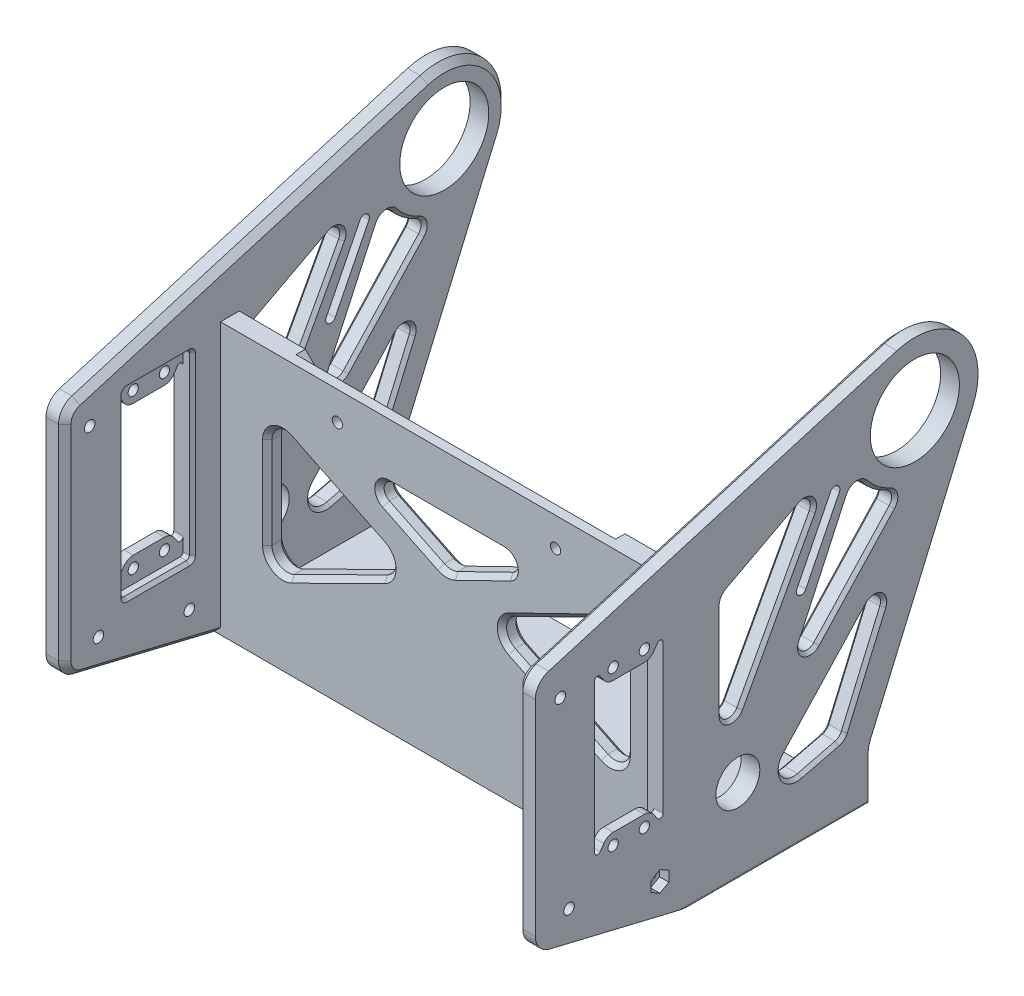
from build123d import *
from OCP.BRepFilletAPI import BRepFilletAPI_MakeFillet

# Parameters (mm, degrees)
SKETCH1_W                = 157
SKETCH1_H                = 87
SKETCH1_W_2              = 145
SKETCH1_H_2              = 75
BOSS_EXTRUDE1_DEPTH      = 50.8
SKETCH2_W                = 157
SKETCH2_H                = 87
BOSS_EXTRUDE2_DEPTH      = 6
SKETCH3_W                = 145
SKETCH3_H                = 7.840397899
CUT_EXTRUDE1_DEPTH       = 179.725040215
CUT_EXTRUDE2_DEPTH       = 179.725040215
FILLET2_R1               = 5
FILLET2_R2               = 3
SKETCH7_R                = 20.2875
SKETCH7_R_2              = 14.2875
BOSS_EXTRUDE3_DEPTH      = 6
FILLET3_R                = 10
CHAMFER2_SIZE            = 5
CUT_EXTRUDE3_DEPTH       = 204.465040379
FILLET4_R1               = 3
FILLET4_R2               = 5
MIRROR2_START            = 145
MIRROR2_DEPTH            = 6
SKETCH10_R               = 7.05
CUT_EXTRUDE4_DEPTH       = 204.465040379
FILLET5_R                = 5
SKETCH12_R               = 1.65
CUT_EXTRUDE9_DEPTH       = 3
SKETCH12_7_R             = 1.65
CUT_EXTRUDE10_DEPTH      = 210.128764909
SKETCH13_R               = 1.65
BOSS_EXTRUDE4_DEPTH      = 6
FILLET6_R                = 1
FILLET6_OF_MIRROR4_R     = 1
CHAMFER3_SIZE            = 6
BOSS_EXTRUDE5_DEPTH      = 6
BOSS_EXTRUDE6_START      = -6
BOSS_EXTRUDE6_DEPTH      = 6
CUT_EXTRUDE11_DEPTH      = 219.472018017
CUT_EXTRUDE11_DEPTH_BACK = 10
SKETCH16_R               = 1.7
FILLET7_R                = 6
CUT_EXTRUDE12_DEPTH      = 3
CUT_EXTRUDE13_DEPTH      = 223.661228453
SKETCH19_W               = 22
SKETCH19_H               = 8
CUT_EXTRUDE14_DEPTH      = 3
FILLET8_R                = 1
CHAMFER4_SIZE            = 1
FILLET8_OF_MIRROR9_R     = 1
CHAMFER5_SIZE            = 1
CHAMFER6_SIZE            = 1
CHAMFER7_SIZE            = 1
CHAMFER8_SIZE            = 2
FILLET9_R                = 1
CHAMFER9_SIZE            = 1.5
CHAMFER10_SIZE           = 1.5


# Read off the part's stored shape, not the designer's step: Mirror2
with BuildPart() as part:
    # Sketch1 → Boss-Extrude1 (new body)
    with BuildSketch(Plane.XY):
        with Locations((72.5, 37.5)):
            Rectangle(SKETCH1_W, SKETCH1_H)
        with Locations((72.5, 37.5)):
            Rectangle(SKETCH1_W_2, SKETCH1_H_2, mode=Mode.SUBTRACT)
    extrude(amount=BOSS_EXTRUDE1_DEPTH)

    # Sketch2 → Boss-Extrude2 (add)
    with BuildSketch(Plane.XY.offset(50.8)):
        with Locations((72.5, 37.5)):
            Rectangle(SKETCH2_W, SKETCH2_H)
    extrude(amount=BOSS_EXTRUDE2_DEPTH)

    # Sketch3 → Cut-Extrude1 (cut, through all)
    with BuildSketch(Plane(origin=(0, 0, 50.8), x_dir=(-1, 0, 0), z_dir=(0, 0, -1))):
        with Locations((-72.5, 78.92019895)):
            Rectangle(SKETCH3_W, SKETCH3_H)
    extrude(amount=CUT_EXTRUDE1_DEPTH, mode=Mode.SUBTRACT)

    # Sketch5 → Cut-Extrude2 (cut, through all)
    with BuildSketch(Plane(origin=(0, 0, 50.8), x_dir=(-1, 0, 0), z_dir=(0, 0, -1))):
        Polygon((-130, 62.996404041), (-83.900811392, 40.5), (-130, 18.003595959), align=None)
        Polygon((-72.534927555, 47.159270504), (-104.039713028, 62.533605815), (-40.991844554, 62.552295009), align=None)
        Polygon((-61.169043718, 40.465910706), (-15, 62.996404041), (-15, 17.590444841), align=None)
    extrude(amount=-CUT_EXTRUDE2_DEPTH, mode=Mode.SUBTRACT)

    # Fillet2: one fillet with a radius per group of edges: ONE call of the kernel's fillet builder (fillet() takes one radius for all edges)
    fillet2_edges_1 = [part.edges().sort_by_distance(p)[0] for p in [
        (130, 62.996404041, 53.8),
        (130, 18.003595959, 53.8),
        (83.900811392, 40.5, 53.8),
        (61.169043718, 40.465910706, 53.8),
        (15, 17.590444841, 53.8),
        (15, 62.996404041, 53.8),
        (72.534927555, 47.159270504, 53.8),
    ]]
    fillet2_edges_2 = [part.edges().sort_by_distance(p)[0] for p in [
        (104.039713028, 62.533605815, 53.8),
        (40.991844554, 62.552295009, 53.8),
    ]]
    fillet2 = BRepFilletAPI_MakeFillet(part.part.solid().wrapped)
    for e in fillet2_edges_1:
        fillet2.Add(FILLET2_R1, e.wrapped)
    for e in fillet2_edges_2:
        fillet2.Add(FILLET2_R2, e.wrapped)
    add(Compound.cast(fillet2.Shape()), mode=Mode.REPLACE)

    # Sketch7 → Boss-Extrude3 (add)
    # profile 1 of 2: a face of its own
    with BuildSketch(Plane.ZY.offset(6)):
        with BuildLine():
            Line((-33.628509731, 87.964996486), (0, 10))
            Line((0, 10), (0, 81))
            Line((0, 81), (56.8, 81))
            Line((56.8, 81), (-5.520454784, 113.936579349))
            ThreePointArc((-5.520454784, 113.936579349), (2.376693152, 106.470586963), (5.2875, 96))
            ThreePointArc((5.2875, 96), (-10.897758839, 76.131575963), (-33.628509731, 87.964996486))
        make_face()
    # profile 2 of 2: a face of its own
    with BuildSketch(Plane.ZY.offset(6)):
        with Locations((-15, 96)):
            Circle(SKETCH7_R)
        with Locations((-15, 96)):
            Circle(SKETCH7_R_2, mode=Mode.SUBTRACT)
    boss_extrude3 = extrude(amount=-BOSS_EXTRUDE3_DEPTH)

    # Mirror1: Boss-Extrude3 across plane
    add(boss_extrude3.mirror(Plane.ZY.offset(-72.5)))

    # Fillet3
    fillet3_edges = [part.edges().sort_by_distance(p)[0] for p in [
        (-3, 10, 0),
        (148, 10, 0),
    ]]
    fillet(fillet3_edges, radius=FILLET3_R)

    # Chamfer2
    chamfer2_edges = [part.edges().sort_by_distance(p)[0] for p in [
        (72.5, 0, 0),
    ]]
    chamfer(chamfer2_edges, length=CHAMFER2_SIZE)

    # Sketch8 → Cut-Extrude3 (cut, through all)
    with BuildSketch(Plane.ZY.offset(6)):
        with BuildLine():
            ThreePointArc((3.752781989, 88.259468757), (-2.075402811, 80.362306955), (-10.928651819, 76.125222511))
            Line((-10.928651819, 76.125222511), (29.206818786, 32.995321266))
            Line((29.206818786, 32.995321266), (3.752781989, 88.259468757))
        make_face()
        Polygon((13.217506745, 92.722815779), (46.8, 30.524174725), (46.8, 74.974350084), align=None)
        Polygon((-11.620030094, 62.189005636), (8.20858058, 16.217965768), (37.949320184, 8.921381013), align=None)
    extrude(amount=-CUT_EXTRUDE3_DEPTH, mode=Mode.SUBTRACT)

    # Fillet4: one fillet with a radius per group of edges: ONE call of the kernel's fillet builder (fillet() takes one radius for all edges)
    fillet4_edges_1 = [part.edges().sort_by_distance(p)[0] for p in [
        (-3, 16.217965768, 8.20858058),
        (-3, 62.189005636, -11.620030094),
        (-3, 88.259468757, 3.752781989),
        (-3, 76.125222511, -10.928651819),
        (-3, 32.995321266, 29.206818786),
        (-3, 30.524174725, 46.8),
        (-3, 74.974350084, 46.8),
        (-3, 92.722815779, 13.217506745),
    ]]
    fillet4_edges_2 = [part.edges().sort_by_distance(p)[0] for p in [
        (-3, 8.921381013, 37.949320184),
    ]]
    fillet4 = BRepFilletAPI_MakeFillet(part.part.solid().wrapped)
    for e in fillet4_edges_1:
        fillet4.Add(FILLET4_R1, e.wrapped)
    for e in fillet4_edges_2:
        fillet4.Add(FILLET4_R2, e.wrapped)
    add(Compound.cast(fillet4.Shape()), mode=Mode.REPLACE)

    # Mirror2 outline → Mirror2 (add)
    with BuildSketch(Plane.YZ.offset(MIRROR2_START)):
        with BuildLine():
            Line((8.921381013, 37.949320184), (12.908216965, 21.699053259))
            ThreePointArc((12.908216965, 21.699053259), (15.23237265, 27.202011091), (21.170392855, 26.550734968))
            Line((21.170392855, 26.550734968), (8.921381013, 37.949320184))
        make_face()
        with BuildLine():
            ThreePointArc((17.587900615, 7.617688905), (16.485574848, 8.434939061), (15.862476884, 9.657546455))
            Line((15.862476884, 9.657546455), (16.217965768, 8.20858058))
            Line((16.217965768, 8.20858058), (17.587900615, 7.617688905))
        make_face()
        with BuildLine():
            Line((62.189005636, -11.620030094), (49.480039969, 0.206575189))
            ThreePointArc((49.480039969, 0.206575189), (49.948450835, -3.629504451), (46.248158166, -4.744291386))
            Line((46.248158166, -4.744291386), (62.189005636, -11.620030094))
        make_face()
        with BuildLine():
            Line((92.722815779, 13.217506745), (88.105787624, 21.953547344))
            ThreePointArc((88.105787624, 21.953547344), (87.565304606, 18.421043559), (84.02813848, 17.911965287))
            Line((84.02813848, 17.911965287), (92.722815779, 13.217506745))
        make_face()
        with BuildLine():
            ThreePointArc((73.16665511, 46.8), (74.714985899, 46.369566455), (75.819014348, 45.201781178))
            Line((75.819014348, 45.201781178), (74.974350084, 46.8))
            Line((74.974350084, 46.8), (73.16665511, 46.8))
        make_face()
        with BuildLine():
            Line((30.524174725, 46.8), (40.969734793, 41.16019912))
            ThreePointArc((40.969734793, 41.16019912), (39.486468129, 44.535050121), (42.395024699, 46.8))
            Line((42.395024699, 46.8), (30.524174725, 46.8))
        make_face()
        with BuildLine():
            ThreePointArc((46.69882818, 16.454721446), (46.250615365, 20.321333526), (49.997579853, 21.375772161))
            Line((49.997579853, 21.375772161), (32.995321266, 29.206818786))
            Line((32.995321266, 29.206818786), (46.69882818, 16.454721446))
        make_face()
        with BuildLine():
            Line((88.259468757, 3.752781989), (83.028913363, 6.16191622))
            ThreePointArc((83.028913363, 6.16191622), (84.754813933, 3.774679153), (83.606546294, 1.061910269))
            ThreePointArc((83.606546294, 1.061910269), (85.843497889, 2.562121772), (88.259468757, 3.752781989))
        make_face()
        with BuildLine():
            ThreePointArc((77.466372753, -6.748496057), (75.325371633, -8.467770526), (72.682014243, -7.724499242))
            Line((72.682014243, -7.724499242), (76.125222511, -10.928651819))
            ThreePointArc((76.125222511, -10.928651819), (76.682396263, -8.802190539), (77.466372753, -6.748496057))
        make_face()
    extrude(amount=MIRROR2_DEPTH)

    # Sketch10 → Cut-Extrude4 (cut, through all)
    with BuildSketch(Plane(origin=(151, 0, 0), x_dir=(0, 0, -1), z_dir=(1, 0, 0))):
        with Locations((-41.8, 21)):
            Circle(SKETCH10_R)
    extrude(amount=-CUT_EXTRUDE4_DEPTH, mode=Mode.SUBTRACT)

    # Fillet5
    fillet5_edges = [part.edges().sort_by_distance(p)[0] for p in [
        (72.5, 0, 50.8),
    ]]
    fillet(fillet5_edges, radius=FILLET5_R)

    # Sketch12 → Cut-Extrude9 (cut)
    # profile 1 of 2: a face of its own
    with BuildSketch(Plane(origin=(0, 0, 50.8), x_dir=(-1, 0, 0), z_dir=(0, 0, -1))):
        with BuildLine():
            Line((-72.5, 66.795063192), (-72.5, 81))
            Line((-72.5, 81), (-123.78828295, 81))
            Line((-123.78828295, 81), (-111.047812236, 68.259529286))
            ThreePointArc((-111.047812236, 68.259529286), (-109.425695492, 67.17566553), (-107.51227833, 66.795063192))
            Line((-107.51227833, 66.795063192), (-72.5, 66.795063192))
        make_face()
        with Locations((-107.51227833, 71.795063192)):
            Circle(SKETCH12_R, mode=Mode.SUBTRACT)
    # profile 2 of 2: a face of its own
    with BuildSketch(Plane(origin=(0, 0, 50.8), x_dir=(-1, 0, 0), z_dir=(0, 0, -1))):
        with BuildLine():
            Line((-21.21171705, 81), (-72.5, 81))
            Line((-72.5, 81), (-72.5, 66.795063192))
            Line((-72.5, 66.795063192), (-37.48772167, 66.795063192))
            ThreePointArc((-37.48772167, 66.795063192), (-35.574304508, 67.17566553), (-33.952187764, 68.259529286))
            Line((-33.952187764, 68.259529286), (-21.21171705, 81))
        make_face()
        with Locations((-37.48772167, 71.795063192)):
            Circle(SKETCH12_R, mode=Mode.SUBTRACT)
    extrude(amount=-CUT_EXTRUDE9_DEPTH, mode=Mode.SUBTRACT)

    # Sketch12<7> → Cut-Extrude10 (cut, through all)
    with BuildSketch(Plane(origin=(0, 0, 50.8), x_dir=(-1, 0, 0), z_dir=(0, 0, -1))):
        with Locations((-107.51227833, 71.795063192)):
            Circle(SKETCH12_7_R)
        with Locations((-37.48772167, 71.795063192)):
            Circle(SKETCH12_7_R)
    extrude(amount=-CUT_EXTRUDE10_DEPTH, mode=Mode.SUBTRACT)

    # Sketch13 → Boss-Extrude4 (add)
    with BuildSketch(Plane(origin=(151, 0, 0), x_dir=(0, 0, -1), z_dir=(1, 0, 0))):
        Polygon((-56.8, -6), (-56.8, 81), (-106.8, 81), (-106.8, 6), align=None)
        with Locations((-81.80010225, 23.5)):
            Circle(SKETCH13_R, mode=Mode.SUBTRACT)
        with Locations((-71.80010225, 23.5)):
            Circle(SKETCH13_R, mode=Mode.SUBTRACT)
        with Locations((-81.80010225, 73)):
            Circle(SKETCH13_R, mode=Mode.SUBTRACT)
        with BuildLine():
            ThreePointArc((-68.800093231, 25.579049274), (-70.106884876, 26.733498867), (-71.80010225, 27.15))
            Line((-71.80010225, 27.15), (-81.80010225, 27.15))
            ThreePointArc((-81.80010225, 27.15), (-83.49337122, 26.733471849), (-84.800177618, 25.578953532))
            Line((-84.800177618, 25.578953532), (-87.8, 21.25))
            Line((-87.8, 21.25), (-87.8, 75.25))
            Line((-87.8, 75.25), (-84.800177618, 70.921046468))
            ThreePointArc((-84.800177618, 70.921046468), (-83.49337122, 69.766528151), (-81.80010225, 69.35))
            Line((-81.80010225, 69.35), (-71.80010225, 69.35))
            ThreePointArc((-71.80010225, 69.350000058), (-70.106357436, 69.766436086), (-68.799230137, 70.921255848))
            Line((-68.799230137, 70.921255848), (-65.8, 75.25))
            Line((-65.8, 75.25), (-65.8, 21.25))
            Line((-65.8, 21.25), (-68.800093231, 25.579049274))
        make_face(mode=Mode.SUBTRACT)
        with Locations((-71.799450587, 73)):
            Circle(SKETCH13_R, mode=Mode.SUBTRACT)
    boss_extrude4 = extrude(amount=-BOSS_EXTRUDE4_DEPTH)

    # Fillet6
    fillet6_edges = [part.edges().sort_by_distance(p)[0] for p in [
        (148, 21.25, 65.8),
        (148, 75.25, 65.8),
        (148, 75.25, 87.8),
        (148, 21.25, 87.8),
    ]]
    fillet(fillet6_edges, radius=FILLET6_R)

    # Mirror4: Boss-Extrude4 across plane
    add(boss_extrude4.mirror(Plane.ZY.offset(-72.5)))

    # Fillet6 of Mirror4
    fillet6_of_mirror4_edges = [part.edges().sort_by_distance(p)[0] for p in [
        (-3, 21.25, 65.8),
        (-3, 75.25, 65.8),
        (-3, 75.25, 87.8),
        (-3, 21.25, 87.8),
    ]]
    fillet(fillet6_of_mirror4_edges, radius=FILLET6_OF_MIRROR4_R)

    # Chamfer3
    chamfer3_edges = [part.edges().sort_by_distance(p)[0] for p in [
        (148, 81, 106.8),
        (-3, 81, 106.8),
    ]]
    chamfer(chamfer3_edges, length=CHAMFER3_SIZE)

    # Sketch14 → Boss-Extrude5 (add)
    with BuildSketch(Plane.ZY.offset(6)):
        with BuildLine():
            Line((100.8, 81), (106.8, 75))
            Line((106.8, 75), (106.8, 81))
            Line((106.8, 81), (-9.225708305, 115.448398692))
            ThreePointArc((-9.225708305, 115.448398692), (-7.335713696, 114.784072287), (-5.520454784, 113.936579349))
            Line((-5.520454784, 113.936579349), (56.8, 81))
            Line((56.8, 81), (100.8, 81))
        make_face()
    extrude(amount=-BOSS_EXTRUDE5_DEPTH)

    # Sketch15 → Boss-Extrude6 (add)
    with BuildSketch(Plane(origin=(151, 0, 0), x_dir=(0, 0, -1), z_dir=(1, 0, 0)).offset(BOSS_EXTRUDE6_START)):
        with BuildLine():
            Line((-106.8, 81), (-106.8, 75))
            Line((-106.8, 75), (-100.8, 81))
            Line((-100.8, 81), (-56.8, 81))
            Line((-56.8, 81), (5.520454784, 113.936579349))
            ThreePointArc((5.520454784, 113.936579349), (7.335713834, 114.784072344), (9.225708592, 115.448398777))
            Line((9.225708592, 115.448398777), (-106.8, 81))
        make_face()
    extrude(amount=BOSS_EXTRUDE6_DEPTH)

    # Sketch16 → Cut-Extrude11 (cut, two sides: drawn at the far end of the back side and taken through both)
    with BuildSketch(Plane(origin=(0, 0, 0), x_dir=(0, 0, -1), z_dir=(1, 0, 0)).offset(-CUT_EXTRUDE11_DEPTH_BACK)):
        with Locations(Location((-66.8, 6, 0), (0, 0, 180))):
            Circle(SKETCH16_R)
        with Locations(Location((-98.8, 73, 0), (0, 0, 180))):
            Circle(SKETCH16_R)
        with Locations(Location((-95.971619059, 13.001188574, 0), (0, 0, 180))):
            Circle(SKETCH16_R)
    extrude(amount=CUT_EXTRUDE11_DEPTH + CUT_EXTRUDE11_DEPTH_BACK, mode=Mode.SUBTRACT)

    # Fillet7
    fillet7_edges = [part.edges().sort_by_distance(p)[0] for p in [
        (148, 6, 106.8),
        (-3, 6, 106.8),
        (-3, 81, 106.8),
        (148, 81, 106.8),
    ]]
    fillet(fillet7_edges, radius=FILLET7_R)

    # Sketch17 → Cut-Extrude12 (cut)
    with BuildSketch(Plane(origin=(151, 0, 0), x_dir=(0, 0, -1), z_dir=(1, 0, 0))):
        Polygon((-66.8, 9.290896534), (-69.65, 7.645448267), (-69.65, 4.354551733), (-66.8, 2.709103466), (-63.95, 4.354551733), (-63.95, 7.645448267), align=None)
    cut_extrude12 = extrude(amount=-CUT_EXTRUDE12_DEPTH, mode=Mode.SUBTRACT)

    # Mirror5: Cut-Extrude12 across plane
    add(cut_extrude12.mirror(Plane.ZY.offset(-72.5)), mode=Mode.SUBTRACT)

    # Sketch18 → Cut-Extrude13 (cut, through all)
    with BuildSketch(Plane.ZY.offset(6)):
        Polygon((21.161663685, 68.677001696), (14.431303731, 82.148848334), (11.614095688, 80.627772174), (18.344455642, 67.155925536), align=None)
        with BuildLine():
            Line((11.614095688, 80.627772174), (14.431303731, 82.148848334))
            Line((14.431303731, 82.148848334), (12.05305154, 86.909284477))
            ThreePointArc((12.05305154, 86.909284477), (9.906662831, 87.625535488), (9.19041182, 85.47914678))
            Line((9.19041182, 85.47914678), (11.614095688, 80.627772174))
        make_face()
        with BuildLine():
            Line((22.880686299, 65.236114555), (21.161663685, 68.677001696))
            Line((21.161663685, 68.677001696), (18.344455642, 67.155925536))
            Line((18.344455642, 67.155925536), (20.01804658, 63.805976857))
            ThreePointArc((20.01804658, 63.805976857), (22.164435288, 63.089725846), (22.880686299, 65.236114555))
        make_face()
    extrude(amount=-CUT_EXTRUDE13_DEPTH, mode=Mode.SUBTRACT)

    # Sketch19 → Cut-Extrude14 (cut)
    with BuildSketch(Plane(origin=(0, 0, 0), x_dir=(0, 0, -1), z_dir=(1, 0, 0))):
        Polygon((-87.8, 69.35), (-81.80010225, 69.35), (-65.8, 69.35), (-65.8, 77.35), (-87.8, 77.35), align=None)
        with Locations((-76.8, 23.15)):
            Rectangle(SKETCH19_W, SKETCH19_H)
    cut_extrude14 = extrude(amount=-CUT_EXTRUDE14_DEPTH, mode=Mode.SUBTRACT)

    # Fillet8
    fillet8_edges = [part.edges().sort_by_distance(p)[0] for p in [
        (-1.5, 77.35, 65.8),
        (-1.5, 77.35, 87.8),
        (-1.5, 19.15, 65.8),
        (-1.5, 19.15, 87.8),
    ]]
    fillet(fillet8_edges, radius=FILLET8_R)

    # Chamfer4
    chamfer4_edges = [part.edges().sort_by_distance(p)[0] for p in [
        (0, 19.15, 76.8),
        (0, 48.25, 87.8),
        (0, 48.25, 65.8),
        (0, 77.35, 76.8),
        (0, 19.442893219, 87.507106781),
        (0, 19.442893219, 66.092893219),
        (0, 77.057106781, 66.092893219),
        (0, 77.057106781, 87.507106781),
    ]]
    chamfer(chamfer4_edges, length=CHAMFER4_SIZE)

    # Mirror9: Cut-Extrude14 across plane
    add(cut_extrude14.mirror(Plane.ZY.offset(-72.5)), mode=Mode.SUBTRACT)

    # Fillet8 of Mirror9
    fillet8_of_mirror9_edges = [part.edges().sort_by_distance(p)[0] for p in [
        (146.5, 77.35, 65.8),
        (146.5, 77.35, 87.8),
        (146.5, 19.15, 65.8),
        (146.5, 19.15, 87.8),
    ]]
    fillet(fillet8_of_mirror9_edges, radius=FILLET8_OF_MIRROR9_R)

    # Chamfer5
    chamfer5_edges = [part.edges().sort_by_distance(p)[0] for p in [
        (145, 48.25, 87.8),
        (145, 19.15, 76.8),
        (145, 48.25, 65.8),
        (145, 77.35, 76.8),
        (145, 19.442893219, 87.507106781),
        (145, 19.442893219, 66.092893219),
        (145, 77.057106781, 66.092893219),
        (145, 77.057106781, 87.507106781),
    ]]
    chamfer(chamfer5_edges, length=CHAMFER5_SIZE)

    # Chamfer6
    chamfer6_edges = [part.edges().sort_by_distance(p)[0] for p in [
        (-6, 35.325216412, 13.378655079),
        (-6, 14.385346925, 15.678299857),
        (-6, 62.498936637, 29.536082203),
        (-6, 81.962400986, 33.577664261),
        (-6, 57.780839904, 46.8),
        (-6, 66.513246608, 13.76884419),
        (-6, 59.690421211, 4.365111102),
        (-6, 80.050965678, -2.461620502),
        (-6, 31.91802939, 1.43669876),
        (-6, 15.23237265, 27.202011091),
        (-6, 87.565304606, 18.421043559),
        (-6, 74.714985899, 46.369566455),
        (-6, 39.486468129, 44.535050121),
        (-6, 46.250615365, 20.321333526),
        (-6, 75.325371633, -8.467770526),
        (-6, 84.754813933, 3.774679153),
        (-6, 49.948450835, -3.629504451),
        (-6, 16.485574848, 8.434939061),
        (151, 35.325216412, 13.378655078),
        (151, 14.385346925, 15.678299857),
        (151, 62.498936636, 29.536082203),
        (151, 81.962400986, 33.577664261),
        (151, 57.780839904, 46.8),
        (151, 66.513246608, 13.76884419),
        (151, 59.690421212, 4.365111102),
        (151, 80.050965678, -2.461620502),
        (151, 31.918029391, 1.43669876),
        (151, 15.23237265, 27.202011091),
        (151, 87.565304606, 18.421043559),
        (151, 74.714985899, 46.369566455),
        (151, 39.486468129, 44.535050121),
        (151, 46.250615365, 20.321333526),
        (151, 75.325371633, -8.467770526),
        (151, 84.754813933, 3.774679153),
        (151, 49.948450835, -3.629504451),
        (151, 16.485574848, 8.434939061),
    ]]
    chamfer(chamfer6_edges, length=CHAMFER6_SIZE)

    # Chamfer7
    chamfer7_edges = [part.edges().sort_by_distance(p)[0] for p in [
        (0, 35.325216412, 13.378655079),
        (0, 14.385346925, 15.678299857),
        (0, 62.498936637, 29.536082203),
        (0, 81.962400986, 33.577664261),
        (0, 57.780839904, 46.8),
        (0, 66.513246608, 13.76884419),
        (0, 59.690421211, 4.365111102),
        (0, 80.050965678, -2.461620502),
        (0, 31.91802939, 1.43669876),
        (0, 15.23237265, 27.202011091),
        (0, 87.565304606, 18.421043559),
        (0, 74.714985899, 46.369566455),
        (0, 39.486468129, 44.535050121),
        (0, 46.250615365, 20.321333526),
        (0, 75.325371633, -8.467770526),
        (0, 84.754813933, 3.774679153),
        (0, 49.948450835, -3.629504451),
        (0, 16.485574848, 8.434939061),
        (145, 35.325216412, 13.378655078),
        (145, 14.385346925, 15.678299857),
        (145, 62.498936636, 29.536082203),
        (145, 81.962400986, 33.577664261),
        (145, 57.780839904, 46.8),
        (145, 66.513246608, 13.76884419),
        (145, 59.690421212, 4.365111102),
        (145, 80.050965678, -2.461620502),
        (145, 31.918029391, 1.43669876),
        (145, 15.23237265, 27.202011091),
        (145, 87.565304606, 18.421043559),
        (145, 74.714985899, 46.369566455),
        (145, 39.486468129, 44.535050121),
        (145, 46.250615365, 20.321333526),
        (145, 75.325371633, -8.467770526),
        (145, 84.754813933, 3.774679153),
        (145, 49.948450835, -3.629504451),
        (145, 16.485574848, 8.434939061),
    ]]
    chamfer(chamfer7_edges, length=CHAMFER7_SIZE)

    # Chamfer8
    chamfer8_edges = [part.edges().sort_by_distance(p)[0] for p in [
        (145, 1.467648075, 0),
        (0, 1.467648075, 0),
        (145, 49.930430609, -17.223124926),
        (0, 49.930430609, -17.223124926),
        (145, 9.95734971, -0.206568559),
        (0, 9.95734971, -0.206568559),
        (0, 109.469988, -30.170434388),
        (0, 98.861392326, 46.641015122),
        (145, 109.469987888, -30.170434487),
        (145, 98.861392369, 46.641014979),
        (0, -0.551971474, 79.500118857),
        (0, 43.626464905, 106.8),
        (0, 80.110972604, 105.608660484),
        (0, 7.015641727, 105.511763273),
        (145, 43.626464905, 106.8),
        (145, -0.551971474, 79.500118857),
        (145, 80.110972604, 105.608660484),
        (145, 7.015641727, 105.511763273),
    ]]
    chamfer(chamfer8_edges, length=CHAMFER8_SIZE)

    # Fillet9
    fillet9_edges = [part.edges().sort_by_distance(p)[0] for p in [
        (151, -6, 28.4),
        (-6, -6, 28.4),
    ]]
    fillet(fillet9_edges, radius=FILLET9_R)

    # Chamfer9
    chamfer9_edges = [part.edges().sort_by_distance(p)[0] for p in [
        (83.551509654, 52.535362569, 50.8),
        (83.551509654, 52.535362569, 56.8),
        (37.111870101, 52.205811432, 50.8),
        (37.111870101, 52.205811432, 56.8),
        (15, 40.320347146, 50.8),
        (15, 40.320347146, 56.8),
        (37.138867619, 28.559632629, 50.8),
        (37.138867619, 28.559632629, 56.8),
        (51.064829639, 60.224044598, 50.8),
        (51.064829639, 60.224044598, 56.8),
        (93.982706873, 60.212188982, 50.8),
        (93.982706873, 60.212188982, 56.8),
        (72.534927555, 47.722866464, 50.8),
        (72.534927555, 47.722866464, 56.8),
        (17.350861641, 59.233334694, 50.8),
        (17.350861641, 59.233334694, 56.8),
        (17.363631238, 21.399408866, 50.8),
        (17.363631238, 21.399408866, 56.8),
        (54.838064809, 40.446863893, 50.8),
        (54.838064809, 40.446863893, 56.8),
        (72.524557472, 62.54294781, 50.8),
        (72.524557472, 62.54294781, 56.8),
        (61.507086087, 52.540857141, 50.8),
        (61.507086087, 52.540857141, 56.8),
    ]]
    chamfer(chamfer9_edges, length=CHAMFER9_SIZE)

    # Chamfer10
    chamfer10_edges = [part.edges().sort_by_distance(p)[0] for p in [
        (107.95798501, 52.239900725, 50.8),
        (107.95798501, 52.239900725, 56.8),
        (107.95798501, 28.760099275, 50.8),
        (107.95798501, 28.760099275, 56.8),
        (130, 40.5, 50.8),
        (130, 40.5, 56.8),
        (90.301622785, 40.5, 50.8),
        (90.301622785, 40.5, 56.8),
        (127.649138359, 21.766665306, 50.8),
        (127.649138359, 21.766665306, 56.8),
        (127.649138359, 59.233334694, 50.8),
        (127.649138359, 59.233334694, 56.8),
    ]]
    chamfer(chamfer10_edges, length=CHAMFER10_SIZE)


solid = part.part
